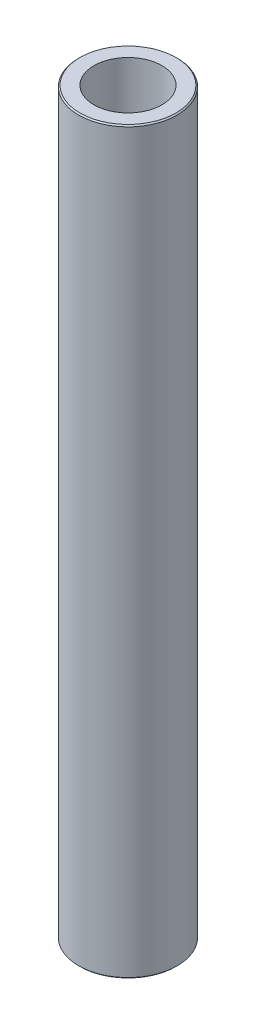
from build123d import *

# Parameters (mm, degrees)
SKETCH1_R           = 40
BOSS_EXTRUDE1_DEPTH = 600
SKETCH2_R           = 27.593631754
CUT_EXTRUDE1_DEPTH  = 603.660766933
CHAMFER1_SIZE       = 0.994176832


with BuildPart() as part:
    # Sketch1 → Boss-Extrude1 (new body)
    with BuildSketch(Plane(origin=(0, 0, 0), x_dir=(1, 0, 0), z_dir=(0, 1, 0))):
        Circle(SKETCH1_R)
    extrude(amount=BOSS_EXTRUDE1_DEPTH)

    # Sketch2 → Cut-Extrude1 (cut, through all)
    with BuildSketch(Plane(origin=(0, 0, 0), x_dir=(1, 0, 0), z_dir=(0, 1, 0))):
        Circle(SKETCH2_R)
    extrude(amount=CUT_EXTRUDE1_DEPTH, mode=Mode.SUBTRACT)

    # Chamfer1
    chamfer1_edges = [part.edges().sort_by_distance(p)[0] for p in [
        (-40, 600, 0),
        (-40, 0, 0),
    ]]
    chamfer(chamfer1_edges, length=CHAMFER1_SIZE)


solid = part.part
